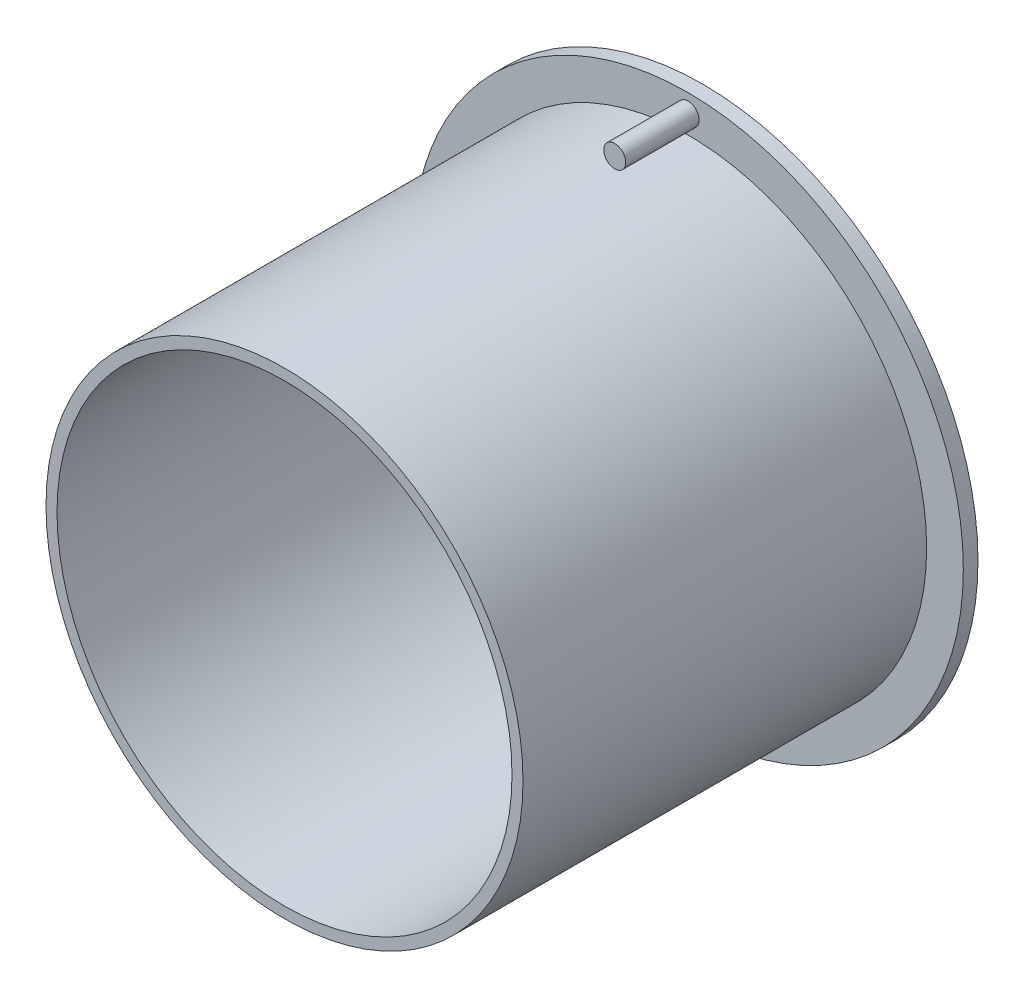
from build123d import *

# Parameters (mm, degrees)
SKETCH1_R           = 37.5
BOSS_EXTRUDE1_DEPTH = 2
SKETCH2_R           = 32.5
SKETCH2_R_2         = 31
BOSS_EXTRUDE2_DEPTH = 55
SKETCH8_R           = 1.5
BOSS_EXTRUDE3_DEPTH = 10


with BuildPart() as part:
    # Sketch1 → Boss-Extrude1 (new body)
    with BuildSketch(Plane.XY):
        Circle(SKETCH1_R)
    extrude(amount=-BOSS_EXTRUDE1_DEPTH)

    # Sketch2 → Boss-Extrude2 (add)
    with BuildSketch(Plane.XY):
        Circle(SKETCH2_R)
        Circle(SKETCH2_R_2, mode=Mode.SUBTRACT)
    extrude(amount=BOSS_EXTRUDE2_DEPTH)

    # Sketch8 → Boss-Extrude3 (add)
    with BuildSketch(Plane.XY):
        with Locations((0, 35)):
            Circle(SKETCH8_R)
        with Locations((0, -35)):
            Circle(SKETCH8_R)
    extrude(amount=BOSS_EXTRUDE3_DEPTH)


solid = part.part
